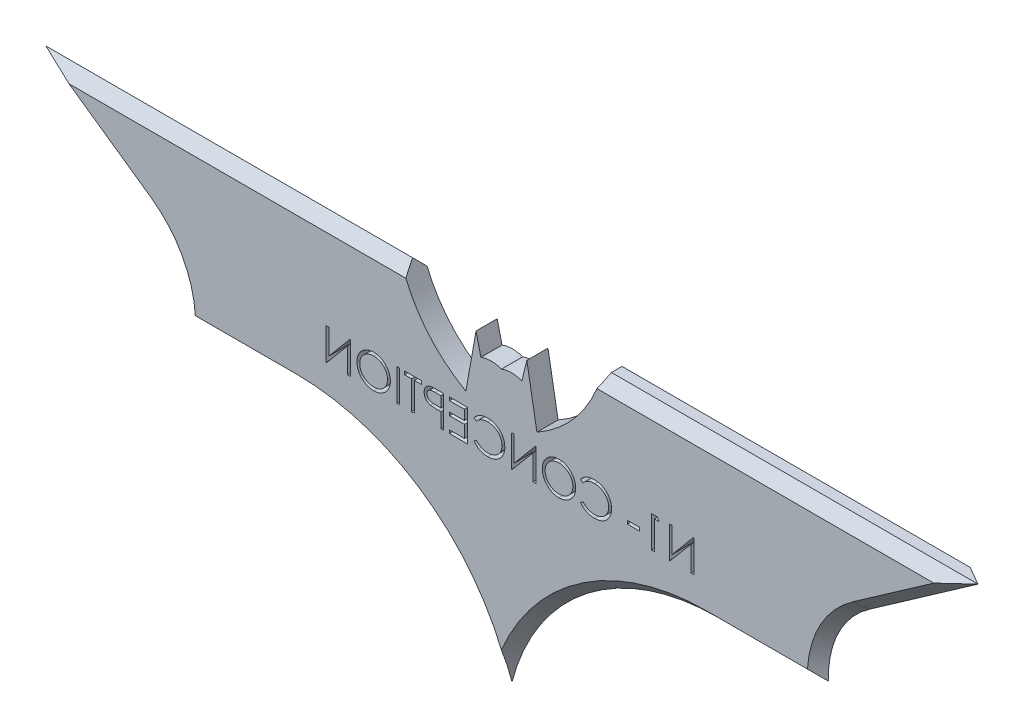
from build123d import *

# Parameters (mm, degrees)
BOSS_EXTRUDE1_DEPTH = 10
CHAMFER1_SIZE       = 5
SKETCH2_W           = 5.769230769
SKETCH2_H           = 1.538461539
SKETCH2_W_2         = 1.346153847
SKETCH2_H_2         = 15
CUT_EXTRUDE1_DEPTH  = 177


with BuildPart() as part:
    # Sketch1 → Boss-Extrude1 (new body)
    with BuildSketch(Plane.XY):
        with BuildLine():
            Line((-9.681048795, 0), (-12, 9.589772968))
            Line((-12, 9.589772968), (-16.760828479, -17.410227032))
            ThreePointArc((-16.760828479, -17.410227032), (-35.36709271, -1.785534949), (-46.917862504, 19.589772968))
            Line((-46.917862504, 19.589772968), (-220, 19.589772968))
            Line((-220, 19.589772968), (-168.614054252, -16.391053603))
            ThreePointArc((-168.614054252, -16.391053603), (-154.02276628, -33.437245106), (-149.476735623, -55.410227032))
            Line((-149.476735623, -55.410227032), (-96.824583655, -55.410227032))
            ThreePointArc((-96.824583655, -55.410227032), (-35.587340086, -76.353285528), (0, -130.410227032))
            ThreePointArc((0, -130.410227032), (35.587340086, -76.353285528), (96.824583655, -55.410227032))
            Line((96.824583655, -55.410227032), (149.476735623, -55.410227032))
            ThreePointArc((149.476735623, -55.410227032), (154.02276628, -33.437245106), (168.614054252, -16.391053603))
            Line((168.614054252, -16.391053603), (220, 19.589772968))
            Line((220, 19.589772968), (46.917862504, 19.589772968))
            ThreePointArc((46.917862504, 19.589772968), (35.36709271, -1.785534949), (16.760828479, -17.410227032))
            Line((16.760828479, -17.410227032), (12, 9.589772968))
            Line((12, 9.589772968), (9.681048795, 0))
            ThreePointArc((9.681048795, 0), (4.840524398, 0.899964765), (0, 0))
            ThreePointArc((0, 0), (-4.840524398, 0.899964765), (-9.681048795, 0))
        make_face()
    extrude(amount=BOSS_EXTRUDE1_DEPTH)

    # Chamfer1
    chamfer1_edges = [part.edges().sort_by_distance(p)[0] for p in [
        (-133.458931252, 19.589772968, 10),
        (-194.307027126, 1.599359682, 10),
        (-154.02276628, -33.437245106, 10),
        (-123.150659639, -55.410227032, 10),
        (-35.587340086, -76.353285528, 10),
        (133.458931252, 19.589772968, 10),
        (194.307027126, 1.599359682, 10),
        (154.02276628, -33.437245106, 10),
        (123.150659639, -55.410227032, 10),
        (35.587340086, -76.353285528, 10),
        (194.307027126, 1.599359682, 0),
        (154.02276628, -33.437245106, 0),
        (123.150659639, -55.410227032, 0),
        (35.587340086, -76.353285528, 0),
        (-133.458931252, 19.589772968, 0),
        (-194.307027126, 1.599359682, 0),
        (-154.02276628, -33.437245106, 0),
        (-123.150659639, -55.410227032, 0),
        (-35.587340086, -76.353285528, 0),
    ]]
    chamfer(chamfer1_edges, length=CHAMFER1_SIZE - 0.0001)  # a hair under: the kernel refuses the full size

    # Sketch2 → Cut-Extrude1 (cut)
    # profile 1 of 13: a face of its own
    with BuildSketch(Plane(origin=(0, 0, 0), x_dir=(-1, 0, 0), z_dir=(0, 0, -1))):
        Polygon((-90.840182606, -38.616878325), (-90.840182606, -23.616878325), (-90.557730683, -23.616878325), (-80.647874913, -35.422767748), (-80.647874913, -23.616878325), (-79.301721067, -23.616878325), (-79.301721067, -38.616878325), (-79.608211452, -38.616878325), (-89.49402876, -26.838032171), (-89.49402876, -38.616878325), align=None)
    # profile 2 of 13: a face of its own
    with BuildSketch(Plane(origin=(0, 0, 0), x_dir=(-1, 0, 0), z_dir=(0, 0, -1))):
        Polygon((-73.613620106, -23.616878325), (-70.840182606, -23.616878325), (-70.840182606, -38.616878325), (-72.186336452, -38.616878325), (-72.186336452, -25.155339863), (-74.49402876, -25.155339863), align=None)
    # profile 3 of 13: a face of its own
    with BuildSketch(Plane(origin=(0, 0, 0), x_dir=(-1, 0, 0), z_dir=(0, 0, -1))):
        with Locations((-62.378644145, -32.847647556)):
            Rectangle(SKETCH2_W, SKETCH2_H)
    # profile 4 of 13: a face of its own
    with BuildSketch(Plane(origin=(0, 0, 0), x_dir=(-1, 0, 0), z_dir=(0, 0, -1))):
        with BuildLine():
            Line((-37.378644144, -26.369282171), (-38.55652876, -27.270724478))
            add(Edge.make_bspline(
                [(-38.55652876, -27.270724478), (-38.640553995, -27.170584608), (-38.807471625, -26.971654969), (-39.076011064, -26.692314064), (-39.355875248, -26.430605801), (-39.646957196, -26.185283459), (-39.954496279, -25.964925892), (-40.271042559, -25.758049737), (-40.601891325, -25.572616574), (-41.059398759, -25.347775205), (-41.657889537, -25.113148826), (-42.41129599, -24.916420692), (-43.197772127, -24.791187082), (-43.734333268, -24.777623476), (-44.007249913, -24.770724478)],
                knots=[0, 0, 0, 0, 0.757959112, 1.505699292, 2.245454638, 2.979532153, 3.711538275, 4.438200793, 5.171680507, 5.909471876, 7.393775596, 8.890124382, 10.418191784, 12, 12, 12, 12], degree=3))
            add(Edge.make_bspline(
                [(-44.007249913, -24.770724478), (-44.157606911, -24.772455746), (-44.45692545, -24.775902214), (-44.901133194, -24.821369894), (-45.33704627, -24.88527508), (-45.764381125, -24.980097893), (-46.182593805, -25.099980547), (-46.594418385, -25.243232321), (-46.993892384, -25.420467349), (-47.386541976, -25.616359891), (-47.762738595, -25.837620369), (-48.1186888, -26.078963305), (-48.453094377, -26.337688004), (-48.766219857, -26.614764175), (-49.05838535, -26.908944005), (-49.327473825, -27.223362612), (-49.572554155, -27.557014784), (-49.798484262, -27.905500817), (-50.000824548, -28.267805638), (-50.170238317, -28.645270225), (-50.320260269, -29.031430667), (-50.438971309, -29.430649928), (-50.532933524, -29.840118924), (-50.597766366, -30.260936587), (-50.642716957, -30.692223785), (-50.646146287, -30.984549411), (-50.647874913, -31.131902363)],
                knots=[0, 0, 0, 0, 1.054917814, 2.100044995, 3.131103042, 4.146048494, 5.169673617, 6.183595914, 7.203665975, 8.234915748, 9.262203917, 10.264457458, 11.251630812, 12.227803204, 13.197192746, 14.159520551, 15.12972552, 16.100847026, 17.073214652, 18.039054194, 19.002613845, 19.979014051, 20.95965708, 21.949030935, 22.966165397, 24, 24, 24, 24], degree=3))
            add(Edge.make_bspline(
                [(-50.647874913, -31.131902363), (-50.642467118, -31.35360802), (-50.631849628, -31.788897669), (-50.537356768, -32.426486), (-50.393763519, -33.037288888), (-50.178553904, -33.617488212), (-49.913186544, -34.174238318), (-49.577869638, -34.698119118), (-49.189513049, -35.197047252), (-48.74262268, -35.659231314), (-48.25231204, -36.081432993), (-47.726249562, -36.4532212), (-47.165745471, -36.763142125), (-46.576988485, -37.021039038), (-45.955447996, -37.219282157), (-45.3022417, -37.358842686), (-44.618790292, -37.449880603), (-44.151778578, -37.458596409), (-43.914100875, -37.463032171)],
                knots=[0, 0, 0, 0, 1.029171465, 2.020641659, 2.987623507, 3.938342917, 4.889210282, 5.84687017, 6.821220943, 7.821438502, 8.827599549, 9.822697543, 10.807740252, 11.797342354, 12.80366471, 13.83203677, 14.896651826, 16, 16, 16, 16], degree=3))
            add(Edge.make_bspline(
                [(-43.914100875, -37.463032171), (-43.652232208, -37.455794543), (-43.136812027, -37.441549161), (-42.380949057, -37.320866665), (-41.657367204, -37.125189874), (-40.966027547, -36.851341635), (-40.308879064, -36.495347544), (-39.684893377, -36.063785213), (-39.093543789, -35.552549501), (-38.737952579, -35.162193237), (-38.55652876, -34.963032171)],
                knots=[0, 0, 0, 0, 1.028121516, 2.023589091, 2.998037872, 3.967518031, 4.937445131, 5.927275754, 6.942489185, 8, 8, 8, 8], degree=3))
            Line((-38.55652876, -34.963032171), (-37.378644144, -35.855460055))
            add(Edge.make_bspline(
                [(-37.378644144, -35.855460055), (-37.473436044, -35.977767706), (-37.662565795, -36.221797162), (-37.968814439, -36.565818775), (-38.291431428, -36.889407499), (-38.632813042, -37.189954447), (-38.989032149, -37.473473585), (-39.366484916, -37.731910005), (-39.760209341, -37.968870937), (-40.168871394, -38.185843471), (-40.592036877, -38.378345958), (-41.029198741, -38.54314782), (-41.478472636, -38.685111632), (-41.939879101, -38.801905647), (-42.414375201, -38.893067435), (-42.900248662, -38.954008899), (-43.398548127, -38.995759961), (-43.734725646, -38.999565314), (-43.905086452, -39.001493709)],
                knots=[0, 0, 0, 0, 0.986787822, 1.968848986, 2.935600012, 3.899624008, 4.868462664, 5.837806735, 6.815139263, 7.798259679, 8.787526145, 9.778297419, 10.776456485, 11.791383307, 12.812564526, 13.85620153, 14.913611965, 16, 16, 16, 16], degree=3))
            add(Edge.make_bspline(
                [(-43.905086452, -39.001493709), (-44.066416454, -39.000370884), (-44.385426554, -38.998150636), (-44.856421204, -38.962184204), (-45.314947979, -38.913113903), (-45.759696375, -38.839227627), (-46.193093411, -38.752037598), (-46.611210202, -38.635160784), (-47.018161103, -38.504235785), (-47.412311135, -38.35035727), (-47.793995563, -38.176716488), (-48.161983326, -37.98046695), (-48.516105179, -37.763258958), (-48.859842697, -37.529880342), (-49.188118055, -37.272834763), (-49.503776021, -36.995692043), (-49.808586633, -36.699386283), (-49.997169569, -36.485722626), (-50.09198549, -36.378296594)],
                knots=[0, 0, 0, 0, 1.114604814, 2.203992996, 3.262667896, 4.300477797, 5.318619304, 6.316056647, 7.298880507, 8.271930387, 9.238335007, 10.195173496, 11.151986948, 12.108099108, 13.064862484, 14.031167946, 15.010108607, 16, 16, 16, 16], degree=3))
            add(Edge.make_bspline(
                [(-50.09198549, -36.378296594), (-50.243852534, -36.191691498), (-50.545753149, -35.820734168), (-50.932006078, -35.219508534), (-51.262638458, -34.591787639), (-51.529963833, -33.934273658), (-51.738946975, -33.248441999), (-51.883723525, -32.533946937), (-51.97780183, -31.791455756), (-51.98856021, -31.286440948), (-51.99402876, -31.029738901)],
                knots=[0, 0, 0, 0, 0.994628077, 1.977248131, 2.950237994, 3.925870899, 4.908910175, 5.911660606, 6.938484602, 8, 8, 8, 8], degree=3))
            add(Edge.make_bspline(
                [(-51.99402876, -31.029738901), (-51.987363644, -30.759929815), (-51.974250446, -30.229097281), (-51.862839894, -29.450066053), (-51.683616482, -28.703702915), (-51.429058388, -27.991401152), (-51.106321168, -27.309414237), (-50.70763568, -26.66295193), (-50.237633642, -26.047879932), (-49.700001209, -25.473530998), (-49.110426915, -24.948362344), (-48.47906057, -24.486335756), (-47.80713794, -24.101832116), (-47.102061433, -23.780419991), (-46.358551369, -23.533372292), (-45.578194073, -23.360430064), (-44.762455866, -23.25278528), (-44.205902614, -23.239177246), (-43.923115298, -23.23226294)],
                knots=[0, 0, 0, 0, 1.032925535, 2.032216505, 3.007276963, 3.968222605, 4.92396291, 5.891752235, 6.871517503, 7.883894988, 8.900124299, 9.891468569, 10.874487609, 11.85992873, 12.854644235, 13.869047385, 14.917252991, 16, 16, 16, 16], degree=3))
            add(Edge.make_bspline(
                [(-43.923115298, -23.23226294), (-43.750767561, -23.234329246), (-43.409622573, -23.238419292), (-42.904968348, -23.278302758), (-42.41364409, -23.344789642), (-41.93531131, -23.435287084), (-41.467642954, -23.547604176), (-41.014213351, -23.69391974), (-40.572361836, -23.86121916), (-40.144875086, -24.0538983), (-39.733804157, -24.270184335), (-39.339277078, -24.507679864), (-38.964427683, -24.766090459), (-38.606618333, -25.043218354), (-38.271834571, -25.344926465), (-37.950571092, -25.662916162), (-37.6537379, -26.006346837), (-37.470509921, -26.248082268), (-37.378644144, -26.369282171)],
                knots=[0, 0, 0, 0, 1.096760587, 2.17092713, 3.219439832, 4.250915756, 5.268269357, 6.278326846, 7.281116186, 8.274029601, 9.260640565, 10.235837813, 11.203064059, 12.156899882, 13.114053108, 14.069676657, 15.032185724, 16, 16, 16, 16], degree=3))
        make_face()
    # profile 5 of 13: a face of its own
    with BuildSketch(Plane(origin=(0, 0, 0), x_dir=(-1, 0, 0), z_dir=(0, 0, -1))):
        with BuildLine():
            add(Edge.make_bspline(
                [(-27.282490298, -23.23226294), (-27.004741273, -23.239297852), (-26.459219271, -23.253114998), (-25.65746971, -23.358882585), (-24.892062159, -23.541862828), (-24.156761564, -23.785561324), (-23.460363093, -24.110651547), (-22.797624982, -24.503587897), (-22.170124094, -24.968487006), (-21.586318173, -25.501755121), (-21.052074101, -26.081969924), (-20.581391731, -26.701160967), (-20.186924758, -27.355584405), (-19.86298567, -28.043273679), (-19.608848771, -28.762673542), (-19.433481441, -29.517619268), (-19.321460798, -30.303219368), (-19.308364609, -30.839048789), (-19.301721067, -31.110868709)],
                knots=[0, 0, 0, 0, 1.065120563, 2.091984664, 3.0946048, 4.079830382, 5.057816894, 6.036188127, 7.030412546, 8.04752943, 9.064399622, 10.05169764, 11.02544977, 11.989514704, 12.962713494, 13.945757189, 14.957906945, 16, 16, 16, 16], degree=3))
            add(Edge.make_bspline(
                [(-19.301721067, -31.110868709), (-19.308363635, -31.380686336), (-19.321456906, -31.912528138), (-19.43360881, -32.693142899), (-19.60949881, -33.443531598), (-19.860625665, -34.162441539), (-20.183020573, -34.850631098), (-20.580114163, -35.506289471), (-21.047862209, -36.129631607), (-21.580177285, -36.713828744), (-22.160467465, -37.24953219), (-22.782882894, -37.716327371), (-23.433425694, -38.118002191), (-24.1204673, -38.438503651), (-24.83489603, -38.694669024), (-25.583105986, -38.869323153), (-26.361591217, -38.98198191), (-26.892466948, -38.994918407), (-27.16229799, -39.001493709)],
                knots=[0, 0, 0, 0, 1.043624062, 2.057103931, 3.04512605, 4.022047818, 4.998200453, 5.980619268, 6.982898556, 8.009068085, 9.034988726, 10.034168286, 11.015286542, 11.987931943, 12.962482838, 13.94673481, 14.956375938, 16, 16, 16, 16], degree=3))
            add(Edge.make_bspline(
                [(-27.16229799, -39.001493709), (-27.4341165, -38.99485348), (-27.96994314, -38.98176382), (-28.756530434, -38.8695578), (-29.51200648, -38.694095069), (-30.234210842, -38.443340342), (-30.923546254, -38.119266496), (-31.581360895, -37.724104872), (-32.205014383, -37.255217124), (-32.789336153, -36.723074661), (-33.323975574, -36.14376801), (-33.790087184, -35.523049774), (-34.18533767, -34.873097817), (-34.508323381, -34.192108428), (-34.764028206, -33.483373673), (-34.938477427, -32.742165913), (-35.051345793, -31.972710888), (-35.064352278, -31.448812752), (-35.070951837, -31.182984094)],
                knots=[0, 0, 0, 0, 1.053102029, 2.075944431, 3.073151272, 4.055350789, 5.033113405, 6.020478099, 7.024410459, 8.052272461, 9.079885166, 10.07527673, 11.055994387, 12.023226415, 12.992069828, 13.970394897, 14.97016774, 16, 16, 16, 16], degree=3))
            add(Edge.make_bspline(
                [(-35.070951837, -31.182984094), (-35.068660541, -31.004558369), (-35.064106857, -30.64995784), (-35.009285318, -30.123386696), (-34.92973517, -29.605283877), (-34.815726973, -29.097122672), (-34.666619829, -28.600147023), (-34.490682569, -28.110929468), (-34.275797517, -27.634427795), (-34.032880454, -27.168384687), (-33.76175842, -26.720065091), (-33.462290922, -26.296295449), (-33.144996486, -25.893519748), (-32.79715337, -25.522175446), (-32.430225748, -25.171459776), (-32.03826127, -24.846762417), (-31.623651652, -24.545155484), (-31.184612881, -24.273354023), (-30.731963132, -24.02752916), (-30.26534837, -23.81657837), (-29.791105921, -23.635523821), (-29.307014572, -23.488777427), (-28.814359835, -23.372925844), (-28.312066472, -23.294037186), (-27.800534646, -23.239075823), (-27.455914707, -23.234543672), (-27.282490298, -23.23226294)],
                knots=[0, 0, 0, 0, 1.037015668, 2.060948919, 3.074880161, 4.083647147, 5.086022904, 6.090072063, 7.104153813, 8.122640571, 9.144368836, 10.147691507, 11.138137339, 12.123020368, 13.103399296, 14.087645067, 15.080126199, 16.082011238, 17.087798457, 18.072939717, 19.057185487, 20.037253025, 21.01195951, 21.997135196, 22.992090687, 24, 24, 24, 24], degree=3))
        make_face()
        with BuildLine():
            add(Edge.make_bspline(
                [(-27.216384529, -24.770724478), (-27.358732958, -24.772459722), (-27.642068957, -24.775913621), (-28.063288398, -24.821409545), (-28.478968114, -24.886251926), (-28.889193952, -24.978744158), (-29.292249478, -25.104761527), (-29.691891654, -25.249793991), (-30.084476171, -25.426455808), (-30.46870699, -25.626053112), (-30.841200169, -25.846977058), (-31.192683176, -26.091141774), (-31.524065936, -26.352821293), (-31.834537078, -26.63262631), (-32.123184959, -26.931981746), (-32.395690822, -27.246349329), (-32.641131887, -27.584714577), (-32.866070073, -27.937902035), (-33.067360817, -28.305451669), (-33.246355194, -28.683493935), (-33.392772375, -29.075112593), (-33.512182559, -29.476058983), (-33.611181749, -29.885698095), (-33.673898566, -30.307137448), (-33.719894392, -30.738259356), (-33.723150873, -31.029610159), (-33.72479799, -31.176974478)],
                knots=[0, 0, 0, 0, 1.008559885, 2.007477868, 2.99961109, 3.989939068, 4.984837346, 5.991145699, 7.001802488, 8.033829008, 9.059044045, 10.069351652, 11.065060232, 12.050310815, 13.029377138, 14.011219647, 14.996725999, 15.989392538, 16.977580475, 17.965360261, 18.951710183, 19.937753436, 20.929683414, 21.935841486, 22.955955122, 24, 24, 24, 24], degree=3))
            add(Edge.make_bspline(
                [(-33.72479799, -31.176974478), (-33.719334296, -31.39366971), (-33.70858552, -31.819976269), (-33.614481648, -32.444696885), (-33.469530329, -33.045075255), (-33.255855901, -33.617826295), (-32.988638981, -34.167873222), (-32.658523737, -34.690336527), (-32.26741337, -35.185357418), (-31.823141114, -35.649479999), (-31.337472371, -36.073104874), (-30.821760671, -36.444948054), (-30.281530925, -36.75956341), (-29.715374342, -37.015870864), (-29.12631346, -37.21896974), (-28.510552527, -37.358163873), (-27.872193415, -37.449772968), (-27.437062036, -37.458570493), (-27.216384529, -37.463032171)],
                knots=[0, 0, 0, 0, 1.032063989, 2.030389145, 3.003944642, 3.970395727, 4.937377036, 5.913328081, 6.909231446, 7.93887556, 8.970685674, 9.976071282, 10.964166581, 11.944589148, 12.933237628, 13.927779006, 14.949070134, 16, 16, 16, 16], degree=3))
            add(Edge.make_bspline(
                [(-27.216384529, -37.463032171), (-27.068058093, -37.460994295), (-26.773882223, -37.456952575), (-26.336329985, -37.41624396), (-25.906660506, -37.35096452), (-25.485476449, -37.256975996), (-25.073255829, -37.139345111), (-24.668278101, -36.999597705), (-24.274856857, -36.82524969), (-23.888028981, -36.632615611), (-23.517759373, -36.413014936), (-23.164292806, -36.177137152), (-22.836538607, -35.915843063), (-22.52629973, -35.640195295), (-22.236466777, -35.344635947), (-21.968999701, -35.029549282), (-21.724799135, -34.692946465), (-21.499946364, -34.340294727), (-21.299360952, -33.971739358), (-21.124593385, -33.592326452), (-20.976324317, -33.202990269), (-20.856630725, -32.803169249), (-20.762835889, -32.393622754), (-20.698207661, -31.973802419), (-20.653000067, -31.544548094), (-20.649592593, -31.254217283), (-20.647874913, -31.107863901)],
                knots=[0, 0, 0, 0, 1.047197238, 2.076906641, 3.100256066, 4.114471768, 5.12198147, 6.126382909, 7.136867548, 8.15857795, 9.17633901, 10.174870724, 11.156907918, 12.133735059, 13.104061851, 14.077631395, 15.04955518, 16.038496417, 17.029181396, 18.010275684, 18.986308667, 19.968651475, 20.955262928, 21.950658345, 22.966943676, 24, 24, 24, 24], degree=3))
            add(Edge.make_bspline(
                [(-20.647874913, -31.107863901), (-20.649593969, -30.96251174), (-20.653004033, -30.674178954), (-20.698186067, -30.247918304), (-20.762904168, -29.831118826), (-20.856172917, -29.425416813), (-20.976387862, -29.030708849), (-21.124619278, -28.647365644), (-21.299413418, -28.273959094), (-21.500020094, -27.911412107), (-21.72551648, -27.563520372), (-21.97192038, -27.230938604), (-22.243486158, -26.91991257), (-22.532454836, -26.622763882), (-22.846044345, -26.345830069), (-23.182834176, -26.089019266), (-23.538735652, -25.846133805), (-23.915566661, -25.627024254), (-24.30446932, -25.424677542), (-24.70352914, -25.2513161), (-25.108225281, -25.104007017), (-25.51752862, -24.978362881), (-25.934884241, -24.886614181), (-26.357472079, -24.82135111), (-26.784707473, -24.775929456), (-27.072035558, -24.772464977), (-27.216384529, -24.770724478)],
                knots=[0, 0, 0, 0, 1.02996197, 2.043119294, 3.035359645, 4.018872909, 4.991431989, 5.957985074, 6.929999688, 7.912076566, 8.892894881, 9.867085534, 10.843653904, 11.817741046, 12.803660682, 13.806313499, 14.818574707, 15.856120519, 16.894564902, 17.924820532, 18.937903209, 19.946497019, 20.957711757, 21.963978472, 22.977135795, 24, 24, 24, 24], degree=3))
        make_face(mode=Mode.SUBTRACT)
    # profile 6 of 13: a face of its own
    with BuildSketch(Plane(origin=(0, 0, 0), x_dir=(-1, 0, 0), z_dir=(0, 0, -1))):
        Polygon((-16.22479799, -38.616878325), (-16.22479799, -23.616878325), (-15.942346067, -23.616878325), (-6.032490298, -35.422767748), (-6.032490298, -23.616878325), (-4.686336452, -23.616878325), (-4.686336452, -38.616878325), (-4.992826837, -38.616878325), (-14.878644144, -26.838032171), (-14.878644144, -38.616878325), align=None)
    # profile 7 of 13: a face of its own
    with BuildSketch(Plane(origin=(0, 0, 0), x_dir=(-1, 0, 0), z_dir=(0, 0, -1))):
        with BuildLine():
            Line((13.00597124, -26.369282171), (11.828086625, -27.270724478))
            add(Edge.make_bspline(
                [(11.828086625, -27.270724478), (11.744061389, -27.170584608), (11.57714376, -26.971654969), (11.308604321, -26.692314064), (11.028740137, -26.430605801), (10.737658189, -26.185283459), (10.430119105, -25.964925892), (10.113572825, -25.758049737), (9.78272406, -25.572616574), (9.325216626, -25.347775205), (8.726725847, -25.113148826), (7.973319394, -24.916420692), (7.186843258, -24.791187082), (6.650282117, -24.777623476), (6.377365471, -24.770724478)],
                knots=[0, 0, 0, 0, 0.757959112, 1.505699292, 2.245454638, 2.979532153, 3.711538275, 4.438200793, 5.171680507, 5.909471876, 7.393775596, 8.890124382, 10.418191784, 12, 12, 12, 12], degree=3))
            add(Edge.make_bspline(
                [(6.377365471, -24.770724478), (6.227008474, -24.772455746), (5.927689934, -24.775902214), (5.483482191, -24.821369894), (5.047569115, -24.88527508), (4.620234259, -24.980097893), (4.20202158, -25.099980547), (3.790197, -25.243232321), (3.390723, -25.420467349), (2.998073408, -25.616359891), (2.62187679, -25.837620369), (2.265926585, -26.078963305), (1.931521008, -26.337688004), (1.618395527, -26.614764175), (1.326230035, -26.908944005), (1.05714156, -27.223362612), (0.81206123, -27.557014784), (0.586131123, -27.905500817), (0.383790837, -28.267805638), (0.214377068, -28.645270225), (0.064355116, -29.031430667), (-0.054355924, -29.430649928), (-0.148318139, -29.840118924), (-0.213150982, -30.260936587), (-0.258101573, -30.692223785), (-0.261530902, -30.984549411), (-0.263259529, -31.131902363)],
                knots=[0, 0, 0, 0, 1.054917814, 2.100044995, 3.131103042, 4.146048494, 5.169673617, 6.183595914, 7.203665975, 8.234915748, 9.262203917, 10.264457458, 11.251630812, 12.227803204, 13.197192746, 14.159520551, 15.12972552, 16.100847026, 17.073214652, 18.039054194, 19.002613845, 19.979014051, 20.95965708, 21.949030935, 22.966165397, 24, 24, 24, 24], degree=3))
            add(Edge.make_bspline(
                [(-0.263259529, -31.131902363), (-0.257851733, -31.35360802), (-0.247234243, -31.788897669), (-0.152741383, -32.426486), (-0.009148135, -33.037288888), (0.206061481, -33.617488212), (0.47142884, -34.174238318), (0.806745747, -34.698119118), (1.195102336, -35.197047252), (1.641992705, -35.659231314), (2.132303345, -36.081432993), (2.658365823, -36.4532212), (3.218869913, -36.763142125), (3.8076269, -37.021039038), (4.429167388, -37.219282157), (5.082373684, -37.358842686), (5.765825092, -37.449880603), (6.232836806, -37.458596409), (6.47051451, -37.463032171)],
                knots=[0, 0, 0, 0, 1.029171465, 2.020641659, 2.987623507, 3.938342917, 4.889210282, 5.84687017, 6.821220943, 7.821438502, 8.827599549, 9.822697543, 10.807740252, 11.797342354, 12.80366471, 13.83203677, 14.896651826, 16, 16, 16, 16], degree=3))
            add(Edge.make_bspline(
                [(6.47051451, -37.463032171), (6.732383177, -37.455794543), (7.247803358, -37.441549161), (8.003666328, -37.320866665), (8.727248181, -37.125189874), (9.418587837, -36.851341635), (10.075736321, -36.495347544), (10.699722008, -36.063785213), (11.291071596, -35.552549501), (11.646662805, -35.162193237), (11.828086625, -34.963032171)],
                knots=[0, 0, 0, 0, 1.028121516, 2.023589091, 2.998037872, 3.967518031, 4.937445131, 5.927275754, 6.942489185, 8, 8, 8, 8], degree=3))
            Line((11.828086625, -34.963032171), (13.00597124, -35.855460055))
            add(Edge.make_bspline(
                [(13.00597124, -35.855460055), (12.911179341, -35.977767706), (12.72204959, -36.221797162), (12.415800946, -36.565818775), (12.093183957, -36.889407499), (11.751802342, -37.189954447), (11.395583236, -37.473473585), (11.018130468, -37.731910005), (10.624406043, -37.968870937), (10.215743991, -38.185843471), (9.792578507, -38.378345958), (9.355416643, -38.54314782), (8.906142748, -38.685111632), (8.444736284, -38.801905647), (7.970240183, -38.893067435), (7.484366723, -38.954008899), (6.986067258, -38.995759961), (6.649889738, -38.999565314), (6.479528933, -39.001493709)],
                knots=[0, 0, 0, 0, 0.986787822, 1.968848986, 2.935600012, 3.899624008, 4.868462664, 5.837806735, 6.815139263, 7.798259679, 8.787526145, 9.778297419, 10.776456485, 11.791383307, 12.812564526, 13.85620153, 14.913611965, 16, 16, 16, 16], degree=3))
            add(Edge.make_bspline(
                [(6.479528933, -39.001493709), (6.318198931, -39.000370884), (5.999188831, -38.998150636), (5.528194181, -38.962184204), (5.069667406, -38.913113903), (4.624919009, -38.839227627), (4.191521974, -38.752037598), (3.773405183, -38.635160784), (3.366454281, -38.504235785), (2.97230425, -38.35035727), (2.590619822, -38.176716488), (2.222632059, -37.98046695), (1.868510206, -37.763258958), (1.524772688, -37.529880342), (1.196497329, -37.272834763), (0.880839364, -36.995692043), (0.576028751, -36.699386283), (0.387445815, -36.485722626), (0.292629894, -36.378296594)],
                knots=[0, 0, 0, 0, 1.114604814, 2.203992996, 3.262667896, 4.300477797, 5.318619304, 6.316056647, 7.298880507, 8.271930387, 9.238335007, 10.195173496, 11.151986948, 12.108099108, 13.064862484, 14.031167946, 15.010108607, 16, 16, 16, 16], degree=3))
            add(Edge.make_bspline(
                [(0.292629894, -36.378296594), (0.140762851, -36.191691498), (-0.161137764, -35.820734168), (-0.547390694, -35.219508534), (-0.878023073, -34.591787639), (-1.145348448, -33.934273658), (-1.35433159, -33.248441999), (-1.49910814, -32.533946937), (-1.593186445, -31.791455756), (-1.603944826, -31.286440948), (-1.609413375, -31.029738901)],
                knots=[0, 0, 0, 0, 0.994628077, 1.977248131, 2.950237994, 3.925870899, 4.908910175, 5.911660606, 6.938484602, 8, 8, 8, 8], degree=3))
            add(Edge.make_bspline(
                [(-1.609413375, -31.029738901), (-1.60274826, -30.759929815), (-1.589635062, -30.229097281), (-1.47822451, -29.450066053), (-1.299001097, -28.703702915), (-1.044443003, -27.991401152), (-0.721705783, -27.309414237), (-0.323020296, -26.66295193), (0.146981743, -26.047879932), (0.684614175, -25.473530998), (1.27418847, -24.948362344), (1.905554815, -24.486335756), (2.577477445, -24.101832116), (3.282553952, -23.780419991), (4.026064016, -23.533372292), (4.806421312, -23.360430064), (5.622159518, -23.25278528), (6.178712771, -23.239177246), (6.461500087, -23.23226294)],
                knots=[0, 0, 0, 0, 1.032925535, 2.032216505, 3.007276963, 3.968222605, 4.92396291, 5.891752235, 6.871517503, 7.883894988, 8.900124299, 9.891468569, 10.874487609, 11.85992873, 12.854644235, 13.869047385, 14.917252991, 16, 16, 16, 16], degree=3))
            add(Edge.make_bspline(
                [(6.461500087, -23.23226294), (6.633847823, -23.234329246), (6.974992812, -23.238419292), (7.479647037, -23.278302758), (7.970971295, -23.344789642), (8.449304075, -23.435287084), (8.91697243, -23.547604176), (9.370402034, -23.69391974), (9.812253549, -23.86121916), (10.239740298, -24.0538983), (10.650811228, -24.270184335), (11.045338307, -24.507679864), (11.420187701, -24.766090459), (11.777997052, -25.043218354), (12.112780814, -25.344926465), (12.434044293, -25.662916162), (12.730877485, -26.006346837), (12.914105464, -26.248082268), (13.00597124, -26.369282171)],
                knots=[0, 0, 0, 0, 1.096760587, 2.17092713, 3.219439832, 4.250915756, 5.268269357, 6.278326846, 7.281116186, 8.274029601, 9.260640565, 10.235837813, 11.203064059, 12.156899882, 13.114053108, 14.069676657, 15.032185724, 16, 16, 16, 16], degree=3))
        make_face()
    # profile 8 of 13: a face of its own
    with BuildSketch(Plane(origin=(0, 0, 0), x_dir=(-1, 0, 0), z_dir=(0, 0, -1))):
        Polygon((16.082894317, -23.616878325), (24.544432779, -23.616878325), (24.544432779, -25.155339863), (17.429048163, -25.155339863), (17.429048163, -29.770724478), (24.544432779, -29.770724478), (24.544432779, -31.309186017), (17.429048163, -31.309186017), (17.429048163, -37.078416786), (24.544432779, -37.078416786), (24.544432779, -38.616878325), (16.082894317, -38.616878325), align=None)
    # profile 9 of 13: a face of its own
    with BuildSketch(Plane(origin=(0, 0, 0), x_dir=(-1, 0, 0), z_dir=(0, 0, -1))):
        with BuildLine():
            Line((27.236740471, -23.616878325), (30.178447202, -23.616878325))
            add(Edge.make_bspline(
                [(30.178447202, -23.616878325), (30.380779657, -23.617100737), (30.768457626, -23.617526889), (31.324379293, -23.630447228), (31.829278143, -23.64770448), (32.28206549, -23.67162688), (32.684134482, -23.699897981), (33.033665766, -23.739549578), (33.333406721, -23.780950845), (33.51300579, -23.823042587), (33.594913548, -23.842238901)],
                knots=[0, 0, 0, 0, 1.415646017, 2.712440637, 3.8905458, 4.950247383, 5.884950622, 6.709939814, 7.411656543, 8, 8, 8, 8], degree=3))
            add(Edge.make_bspline(
                [(33.594913548, -23.842238901), (33.698600121, -23.870618686), (33.903530024, -23.926709522), (34.198820209, -24.039054051), (34.479765261, -24.172263331), (34.747329082, -24.324080216), (34.998223724, -24.501018348), (35.236192471, -24.695905281), (35.459135244, -24.913240575), (35.665798352, -25.150586603), (35.855590342, -25.403958931), (36.019003268, -25.677139916), (36.155834241, -25.965531217), (36.273191118, -26.268932236), (36.357655923, -26.589890765), (36.421285493, -26.926176676), (36.461672469, -27.277753919), (36.465540591, -27.518010494), (36.467509702, -27.640315825)],
                knots=[0, 0, 0, 0, 0.999701418, 1.975846123, 2.934577507, 3.890451536, 4.834027766, 5.787354733, 6.749476667, 7.726910423, 8.712836071, 9.690891519, 10.682875813, 11.679750201, 12.712814741, 13.765529915, 14.8625177, 16, 16, 16, 16], degree=3))
            add(Edge.make_bspline(
                [(36.467509702, -27.640315825), (36.465703596, -27.763649154), (36.462169828, -28.004959142), (36.419757176, -28.357985377), (36.362627784, -28.695349906), (36.274783274, -29.016304694), (36.159730389, -29.31894371), (36.024764448, -29.607891847), (35.861977889, -29.878233298), (35.674928619, -30.130949516), (35.466850358, -30.366277712), (35.23862348, -30.582512546), (34.991169369, -30.778388282), (34.725274449, -30.95434404), (34.438346525, -31.106299524), (34.134737296, -31.242402259), (33.811807797, -31.356706805), (33.58833988, -31.41683564), (33.47472124, -31.447407171)],
                knots=[0, 0, 0, 0, 1.121902311, 2.195077645, 3.232258892, 4.234102512, 5.217864754, 6.176164875, 7.132989551, 8.084763148, 9.034132444, 9.988522005, 10.94243251, 11.903244335, 12.886203696, 13.894208494, 14.929344452, 16, 16, 16, 16], degree=3))
            add(Edge.make_bspline(
                [(33.47472124, -31.447407171), (33.380746952, -31.467391375), (33.174796835, -31.511187922), (32.83561374, -31.560081308), (32.440704943, -31.601813883), (31.990609457, -31.633104472), (31.485731293, -31.659891766), (30.925797333, -31.681183597), (30.309708431, -31.69288297), (29.879974528, -31.693486368), (29.655610663, -31.693801401)],
                knots=[0, 0, 0, 0, 0.601384939, 1.31797006, 2.144135048, 3.087295005, 4.142315834, 5.309527816, 6.595305764, 8, 8, 8, 8], degree=3))
            Line((29.655610663, -31.693801401), (28.582894317, -31.693801401))
            Line((28.582894317, -31.693801401), (28.582894317, -38.616878325))
            Line((28.582894317, -38.616878325), (27.236740471, -38.616878325))
            Line((27.236740471, -38.616878325), (27.236740471, -23.616878325))
        make_face()
        with BuildLine():
            Line((28.582894317, -25.155339863), (28.582894317, -30.155339863))
            Line((28.582894317, -30.155339863), (31.20909624, -30.188392748))
            add(Edge.make_bspline(
                [(31.20909624, -30.188392748), (31.337324494, -30.18845902), (31.584866494, -30.188586958), (31.942450307, -30.171507429), (32.274204396, -30.15179086), (32.579109719, -30.122922617), (32.857303724, -30.082117228), (33.109250276, -30.040924065), (33.332995774, -29.981329654), (33.594849496, -29.901087929), (33.886635271, -29.764233862), (34.204067622, -29.565591476), (34.473084421, -29.312388441), (34.705877121, -29.027697735), (34.890616598, -28.71098718), (35.025856565, -28.372120309), (35.105318668, -28.014572382), (35.115973784, -27.76990893), (35.121355856, -27.64632544)],
                knots=[0, 0, 0, 0, 1.160613943, 2.240541288, 3.23993089, 4.169200891, 5.011653406, 5.7853311, 6.478053781, 7.106038997, 8.262395093, 9.384106736, 10.481365981, 11.59014053, 12.70357646, 13.786202915, 14.881775077, 16, 16, 16, 16], degree=3))
            add(Edge.make_bspline(
                [(35.121355856, -27.64632544), (35.115944514, -27.525731811), (35.105187435, -27.286006602), (35.025233736, -26.934669056), (34.890879534, -26.59937318), (34.704636986, -26.286631386), (34.478603572, -26.002965083), (34.215892101, -25.756548824), (33.917120981, -25.558455813), (33.639199991, -25.430598891), (33.392337765, -25.352533425), (33.17791508, -25.29791268), (32.935812189, -25.254302939), (32.665950277, -25.218990784), (32.370420989, -25.188761665), (32.046685354, -25.168250334), (31.69596974, -25.156244093), (31.452495865, -25.15564857), (31.32628374, -25.155339863)],
                knots=[0, 0, 0, 0, 1.120700087, 2.227813068, 3.331159281, 4.466773991, 5.599788987, 6.693661531, 7.80175334, 8.91857717, 9.525282508, 10.207424825, 10.974604443, 11.810962634, 12.737642355, 13.736264703, 14.826523623, 16, 16, 16, 16], degree=3))
            Line((31.32628374, -25.155339863), (28.582894317, -25.155339863))
        make_face(mode=Mode.SUBTRACT)
    # profile 10 of 13: a face of its own
    with BuildSketch(Plane(origin=(0, 0, 0), x_dir=(-1, 0, 0), z_dir=(0, 0, -1))):
        Polygon((37.813663548, -25.155339863), (37.813663548, -23.616878325), (45.698278933, -23.616878325), (45.698278933, -25.155339863), (42.429048163, -25.155339863), (42.429048163, -38.616878325), (41.082894317, -38.616878325), (41.082894317, -25.155339863), align=None)
    # profile 11 of 13: a face of its own
    with BuildSketch(Plane(origin=(0, 0, 0), x_dir=(-1, 0, 0), z_dir=(0, 0, -1))):
        with Locations((48.679048163, -31.116878325)):
            Rectangle(SKETCH2_W_2, SKETCH2_H_2)
    # profile 12 of 13: a face of its own
    with BuildSketch(Plane(origin=(0, 0, 0), x_dir=(-1, 0, 0), z_dir=(0, 0, -1))):
        with BuildLine():
            add(Edge.make_bspline(
                [(60.217509702, -23.23226294), (60.495258727, -23.239297852), (61.040780729, -23.253114998), (61.84253029, -23.358882585), (62.607937841, -23.541862828), (63.343238436, -23.785561324), (64.039636907, -24.110651547), (64.702375018, -24.503587897), (65.329875906, -24.968487006), (65.913681827, -25.501755121), (66.447925899, -26.081969924), (66.918608269, -26.701160967), (67.313075242, -27.355584405), (67.63701433, -28.043273679), (67.891151229, -28.762673542), (68.066518559, -29.517619268), (68.178539202, -30.303219368), (68.191635391, -30.839048789), (68.198278933, -31.110868709)],
                knots=[0, 0, 0, 0, 1.065120563, 2.091984664, 3.0946048, 4.079830382, 5.057816894, 6.036188127, 7.030412546, 8.04752943, 9.064399622, 10.05169764, 11.02544977, 11.989514704, 12.962713494, 13.945757189, 14.957906945, 16, 16, 16, 16], degree=3))
            add(Edge.make_bspline(
                [(68.198278933, -31.110868709), (68.191636365, -31.380686336), (68.178543094, -31.912528138), (68.06639119, -32.693142899), (67.89050119, -33.443531598), (67.639374335, -34.162441539), (67.316979427, -34.850631098), (66.919885837, -35.506289471), (66.452137791, -36.129631607), (65.919822715, -36.713828744), (65.339532535, -37.24953219), (64.717117106, -37.716327371), (64.066574306, -38.118002191), (63.3795327, -38.438503651), (62.66510397, -38.694669024), (61.916894014, -38.869323153), (61.138408783, -38.98198191), (60.607533052, -38.994918407), (60.33770201, -39.001493709)],
                knots=[0, 0, 0, 0, 1.043624062, 2.057103931, 3.04512605, 4.022047818, 4.998200453, 5.980619268, 6.982898556, 8.009068085, 9.034988726, 10.034168286, 11.015286542, 11.987931943, 12.962482838, 13.94673481, 14.956375938, 16, 16, 16, 16], degree=3))
            add(Edge.make_bspline(
                [(60.33770201, -39.001493709), (60.0658835, -38.99485348), (59.53005686, -38.98176382), (58.743469566, -38.8695578), (57.98799352, -38.694095069), (57.265789158, -38.443340342), (56.576453746, -38.119266496), (55.918639105, -37.724104872), (55.294985617, -37.255217124), (54.710663847, -36.723074661), (54.176024426, -36.14376801), (53.709912816, -35.523049774), (53.31466233, -34.873097817), (52.991676619, -34.192108428), (52.735971794, -33.483373673), (52.561522573, -32.742165913), (52.448654207, -31.972710888), (52.435647722, -31.448812752), (52.429048163, -31.182984094)],
                knots=[0, 0, 0, 0, 1.053102029, 2.075944431, 3.073151272, 4.055350789, 5.033113405, 6.020478099, 7.024410459, 8.052272461, 9.079885166, 10.07527673, 11.055994387, 12.023226415, 12.992069828, 13.970394897, 14.97016774, 16, 16, 16, 16], degree=3))
            add(Edge.make_bspline(
                [(52.429048163, -31.182984094), (52.431339459, -31.004558369), (52.435893143, -30.64995784), (52.490714682, -30.123386696), (52.57026483, -29.605283877), (52.684273027, -29.097122672), (52.833380171, -28.600147023), (53.009317431, -28.110929468), (53.224202483, -27.634427795), (53.467119546, -27.168384687), (53.73824158, -26.720065091), (54.037709078, -26.296295449), (54.355003514, -25.893519748), (54.70284663, -25.522175446), (55.069774252, -25.171459776), (55.46173873, -24.846762417), (55.876348348, -24.545155484), (56.315387119, -24.273354023), (56.768036868, -24.02752916), (57.23465163, -23.81657837), (57.708894079, -23.635523821), (58.192985428, -23.488777427), (58.685640165, -23.372925844), (59.187933528, -23.294037186), (59.699465354, -23.239075823), (60.044085293, -23.234543672), (60.217509702, -23.23226294)],
                knots=[0, 0, 0, 0, 1.037015668, 2.060948919, 3.074880161, 4.083647147, 5.086022904, 6.090072063, 7.104153813, 8.122640571, 9.144368836, 10.147691507, 11.138137339, 12.123020368, 13.103399296, 14.087645067, 15.080126199, 16.082011238, 17.087798457, 18.072939717, 19.057185487, 20.037253025, 21.01195951, 21.997135196, 22.992090687, 24, 24, 24, 24], degree=3))
        make_face()
        with BuildLine():
            add(Edge.make_bspline(
                [(60.283615471, -24.770724478), (60.141267042, -24.772459722), (59.857931043, -24.775913621), (59.436711602, -24.821409545), (59.021031886, -24.886251926), (58.610806048, -24.978744158), (58.207750522, -25.104761527), (57.808108346, -25.249793991), (57.415523829, -25.426455808), (57.03129301, -25.626053112), (56.658799831, -25.846977058), (56.307316824, -26.091141774), (55.975934064, -26.352821293), (55.665462922, -26.63262631), (55.376815041, -26.931981746), (55.104309178, -27.246349329), (54.858868113, -27.584714577), (54.633929927, -27.937902035), (54.432639183, -28.305451669), (54.253644806, -28.683493935), (54.107227625, -29.075112593), (53.987817441, -29.476058983), (53.888818251, -29.885698095), (53.826101434, -30.307137448), (53.780105608, -30.738259356), (53.776849127, -31.029610159), (53.77520201, -31.176974478)],
                knots=[0, 0, 0, 0, 1.008559885, 2.007477868, 2.99961109, 3.989939068, 4.984837346, 5.991145699, 7.001802488, 8.033829008, 9.059044045, 10.069351652, 11.065060232, 12.050310815, 13.029377138, 14.011219647, 14.996725999, 15.989392538, 16.977580475, 17.965360261, 18.951710183, 19.937753436, 20.929683414, 21.935841486, 22.955955122, 24, 24, 24, 24], degree=3))
            add(Edge.make_bspline(
                [(53.77520201, -31.176974478), (53.780665704, -31.39366971), (53.79141448, -31.819976269), (53.885518352, -32.444696885), (54.030469671, -33.045075255), (54.244144099, -33.617826295), (54.511361019, -34.167873222), (54.841476263, -34.690336527), (55.23258663, -35.185357418), (55.676858886, -35.649479999), (56.162527629, -36.073104874), (56.678239329, -36.444948054), (57.218469075, -36.75956341), (57.784625658, -37.015870864), (58.37368654, -37.21896974), (58.989447473, -37.358163873), (59.627806585, -37.449772968), (60.062937964, -37.458570493), (60.283615471, -37.463032171)],
                knots=[0, 0, 0, 0, 1.032063989, 2.030389145, 3.003944642, 3.970395727, 4.937377036, 5.913328081, 6.909231446, 7.93887556, 8.970685674, 9.976071282, 10.964166581, 11.944589148, 12.933237628, 13.927779006, 14.949070134, 16, 16, 16, 16], degree=3))
            add(Edge.make_bspline(
                [(60.283615471, -37.463032171), (60.431941907, -37.460994295), (60.726117777, -37.456952575), (61.163670015, -37.41624396), (61.593339494, -37.35096452), (62.014523551, -37.256975996), (62.426744171, -37.139345111), (62.831721899, -36.999597705), (63.225143143, -36.82524969), (63.611971019, -36.632615611), (63.982240627, -36.413014936), (64.335707194, -36.177137152), (64.663461393, -35.915843063), (64.97370027, -35.640195295), (65.263533223, -35.344635947), (65.531000299, -35.029549282), (65.775200865, -34.692946465), (66.000053636, -34.340294727), (66.200639048, -33.971739358), (66.375406615, -33.592326452), (66.523675683, -33.202990269), (66.643369275, -32.803169249), (66.737164111, -32.393622754), (66.801792339, -31.973802419), (66.846999933, -31.544548094), (66.850407407, -31.254217283), (66.852125087, -31.107863901)],
                knots=[0, 0, 0, 0, 1.047197238, 2.076906641, 3.100256066, 4.114471768, 5.12198147, 6.126382909, 7.136867548, 8.15857795, 9.17633901, 10.174870724, 11.156907918, 12.133735059, 13.104061851, 14.077631395, 15.04955518, 16.038496417, 17.029181396, 18.010275684, 18.986308667, 19.968651475, 20.955262928, 21.950658345, 22.966943676, 24, 24, 24, 24], degree=3))
            add(Edge.make_bspline(
                [(66.852125087, -31.107863901), (66.850406031, -30.96251174), (66.846995967, -30.674178954), (66.801813933, -30.247918304), (66.737095832, -29.831118826), (66.643827083, -29.425416813), (66.523612138, -29.030708849), (66.375380722, -28.647365644), (66.200586582, -28.273959094), (65.999979906, -27.911412107), (65.77448352, -27.563520372), (65.52807962, -27.230938604), (65.256513842, -26.91991257), (64.967545164, -26.622763882), (64.653955655, -26.345830069), (64.317165824, -26.089019266), (63.961264348, -25.846133805), (63.584433339, -25.627024254), (63.19553068, -25.424677542), (62.79647086, -25.2513161), (62.391774719, -25.104007017), (61.98247138, -24.978362881), (61.565115759, -24.886614181), (61.142527921, -24.82135111), (60.715292527, -24.775929456), (60.427964442, -24.772464977), (60.283615471, -24.770724478)],
                knots=[0, 0, 0, 0, 1.02996197, 2.043119294, 3.035359645, 4.018872909, 4.991431989, 5.957985074, 6.929999688, 7.912076566, 8.892894881, 9.867085534, 10.843653904, 11.817741046, 12.803660682, 13.806313499, 14.818574707, 15.856120519, 16.894564902, 17.924820532, 18.937903209, 19.946497019, 20.957711757, 21.963978472, 22.977135795, 24, 24, 24, 24], degree=3))
        make_face(mode=Mode.SUBTRACT)
    # profile 13 of 13: a face of its own
    with BuildSketch(Plane(origin=(0, 0, 0), x_dir=(-1, 0, 0), z_dir=(0, 0, -1))):
        Polygon((71.27520201, -38.616878325), (71.27520201, -23.616878325), (71.557653933, -23.616878325), (81.467509702, -35.422767748), (81.467509702, -23.616878325), (82.813663548, -23.616878325), (82.813663548, -38.616878325), (82.507173163, -38.616878325), (72.621355856, -26.838032171), (72.621355856, -38.616878325), align=None)
    extrude(amount=-CUT_EXTRUDE1_DEPTH, mode=Mode.SUBTRACT)


with BuildPart() as cut_extrude1_piece_1:
    # of the separate pieces the step leaves, piece 1, a body of its own (cut_extrude1_pieces)
    add(part.part.solids().sort_by_distance((-46.917862504, 19.589772968, 4.9999))[0])


with BuildPart() as cut_extrude1_piece_2:
    # of the separate pieces the step leaves, piece 2, a body of its own (cut_extrude1_pieces)
    add(part.part.solids().sort_by_distance((27.216384529, -24.770724478, 0))[0])


with BuildPart() as cut_extrude1_piece_3:
    # of the separate pieces the step leaves, piece 3, a body of its own (cut_extrude1_pieces)
    add(part.part.solids().sort_by_distance((-60.283615471, -24.770724478, 0))[0])


with BuildPart() as cut_extrude1_piece_4:
    # of the separate pieces the step leaves, piece 4, a body of its own (cut_extrude1_pieces)
    add(part.part.solids().sort_by_distance((-28.582894317, -25.155339863, 0))[0])


solid = Compound([cut_extrude1_piece_1.part, cut_extrude1_piece_2.part, cut_extrude1_piece_3.part, cut_extrude1_piece_4.part])
